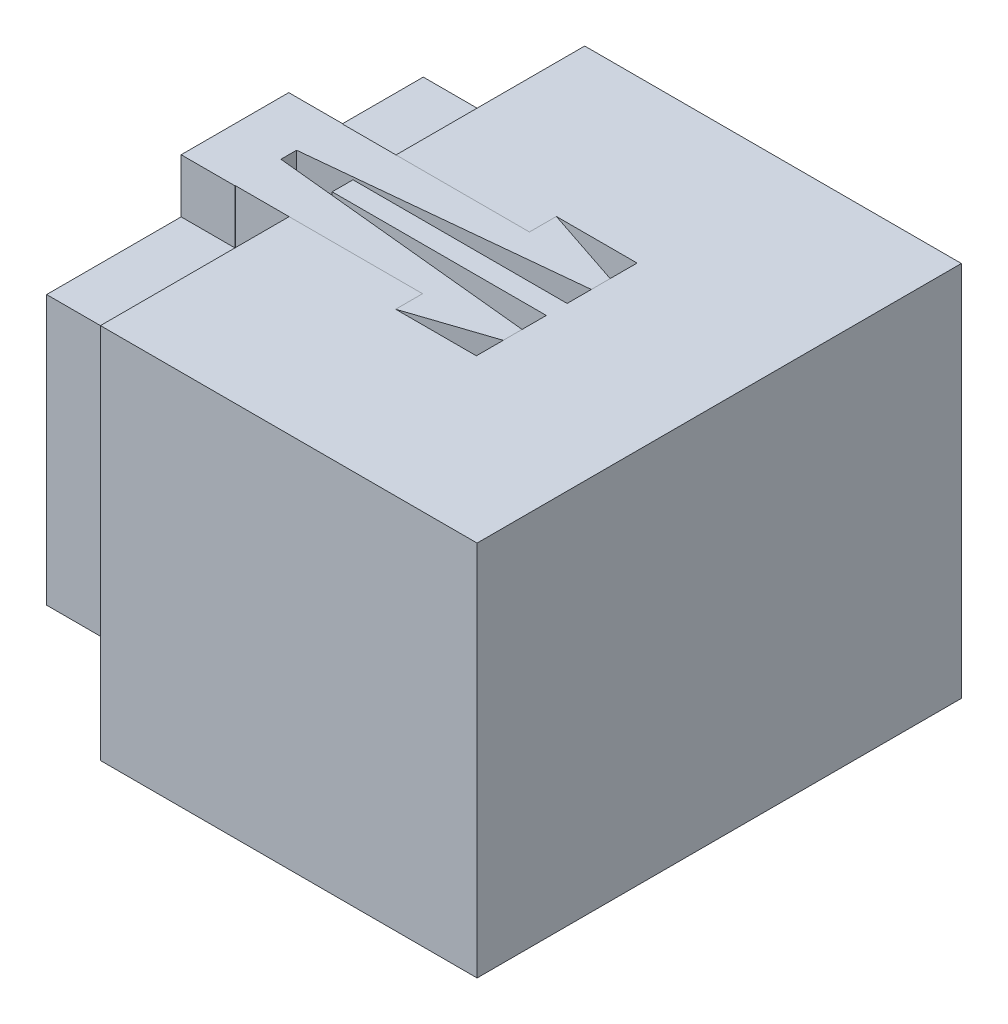
from build123d import *

# Parameters (mm, degrees)
SKETCH1_W                = 7
SKETCH1_H                = 5
BOSS_EXTRUDE1_DEPTH      = 1
SKETCH3_W                = 5
SKETCH3_H                = 4
BOSS_EXTRUDE2_DEPTH      = 7
SKETCH4_W                = 1
SKETCH4_H                = 1
CUT_EXTRUDE1_DEPTH       = 5
CUT_EXTRUDE3_DEPTH       = 4
SKETCH7_W                = 2
SKETCH7_H                = 1
BOSS_EXTRUDE3_DEPTH      = 1
SNAP_START               = 2.5
SNAP_HOOK3_DEPTH         = 1
SKETCH8_R                = 0.5
CUT_EXTRUDE4_DEPTH       = 1
SKETCH9_W                = 9
SKETCH9_H                = 7
BOSS_EXTRUDE4_DEPTH      = 7
SKETCH10_W               = 7
SKETCH10_H               = 5
CUT_EXTRUDE5_DEPTH       = 6
SNAP_START_2             = 2
SNAP_GROOVE1_OUTLINE_W   = 1
SNAP_GROOVE1_OUTLINE_H   = 0.8
SNAP_GROOVE1_DEPTH       = 3.979788025
SNAP_START_3             = 4.479788025
SNAP_GROOVE1_2_OUTLINE_W = 1
SNAP_GROOVE1_2_OUTLINE_H = 0.5
SNAP_GROOVE1_2_DEPTH     = 1.5


# Read off the part's stored shape, not the designer's step: Snap Hook3, Snap Groove1
with BuildPart() as part:
    # Sketch1 → Boss-Extrude1 (new body)
    with BuildSketch(Plane(origin=(0, 0, 0), x_dir=(0, 0, -1), z_dir=(1, 0, 0))):
        Rectangle(SKETCH1_W, SKETCH1_H)
    extrude(amount=BOSS_EXTRUDE1_DEPTH)

    # Sketch3 → Boss-Extrude2 (add)
    with BuildSketch(Plane(origin=(1, 0, 0), x_dir=(0, 0, -1), z_dir=(1, 0, 0))):
        with Locations((0, 0.5)):
            Rectangle(SKETCH3_W, SKETCH3_H)
    extrude(amount=BOSS_EXTRUDE2_DEPTH)

    # Sketch4 → Cut-Extrude1 (cut)
    with BuildSketch(Plane(origin=(8, 0, 0), x_dir=(0, 0, -1), z_dir=(1, 0, 0))):
        with Locations((-1.5, 1.5)):
            Rectangle(SKETCH4_W, SKETCH4_H)
        with Locations((1.5, 1.5)):
            Rectangle(SKETCH4_W, SKETCH4_H)
    extrude(amount=-CUT_EXTRUDE1_DEPTH, mode=Mode.SUBTRACT)

    # Sketch6 → Cut-Extrude3 (cut)
    with BuildSketch(Plane(origin=(8, 0, 0), x_dir=(0, 0, -1), z_dir=(1, 0, 0))):
        Polygon((-1.6, -1.5), (-1.4, -0.8), (-0.6, -0.8), (-0.4, -1.5), align=None)
        Polygon((0.4, -1.5), (1.6, -1.5), (1.4, -0.8), (0.6, -0.8), align=None)
    extrude(amount=-CUT_EXTRUDE3_DEPTH, mode=Mode.SUBTRACT)

    # Sketch7 → Boss-Extrude3 (add)
    with BuildSketch(Plane.ZY):
        with Locations((0, 3)):
            Rectangle(SKETCH7_W, SKETCH7_H)
    extrude(amount=-BOSS_EXTRUDE3_DEPTH)

    # Snap Hook3 outline → Snap Hook3 (add)
    with BuildSketch(Plane(origin=(0, 0, 0), x_dir=(1, 0, 0), z_dir=(0, 1, 0)).offset(SNAP_START)):
        Polygon((5.979788025, 0.993352766), (4.479788025, 1.493352766), (4.479788025, 0.993352766), (1, 0.993352766), (1, 0.145373963), (5.979788025, 0.643352766), align=None)
    snap_hook3 = extrude(amount=SNAP_HOOK3_DEPTH)

    # Mirror1: Snap Hook3 across plane
    add(snap_hook3.mirror(Plane.XY))

    # Sketch8 → Cut-Extrude4 (cut)
    with BuildSketch(Plane.ZY):
        with Locations((-1.5, 0)):
            Circle(SKETCH8_R)
        with Locations((1.5, 0)):
            Circle(SKETCH8_R)
    extrude(amount=-CUT_EXTRUDE4_DEPTH, mode=Mode.SUBTRACT)


with BuildPart() as body_2:
    # Sketch9 → Boss-Extrude4 (new body)
    with BuildSketch(Plane(origin=(9, 0, 0), x_dir=(0, 0, -1), z_dir=(1, 0, 0))):
        Rectangle(SKETCH9_W, SKETCH9_H)
    extrude(amount=-BOSS_EXTRUDE4_DEPTH)

    # Sketch10 → Cut-Extrude5 (cut)
    with BuildSketch(Plane.ZY.offset(-2)):
        Rectangle(SKETCH10_W, SKETCH10_H)
    extrude(amount=-CUT_EXTRUDE5_DEPTH, mode=Mode.SUBTRACT)

    # Snap Groove1 outline → Snap Groove1 (cut)
    with BuildSketch(Plane.YZ.offset(SNAP_START_2)):
        with Locations((3, -0.593352766)):
            Rectangle(SNAP_GROOVE1_OUTLINE_W, SNAP_GROOVE1_OUTLINE_H)
    snap_groove1 = extrude(amount=SNAP_GROOVE1_DEPTH, mode=Mode.SUBTRACT)

    # Snap Groove1 2 outline → Snap Groove1 2 (cut)
    with BuildSketch(Plane.YZ.offset(SNAP_START_3)):
        with Locations((3, -1.243352766)):
            Rectangle(SNAP_GROOVE1_2_OUTLINE_W, SNAP_GROOVE1_2_OUTLINE_H)
    snap_groove1_2 = extrude(amount=SNAP_GROOVE1_2_DEPTH, mode=Mode.SUBTRACT)

    # Mirror2: Snap Groove1, Snap Groove1 2 across plane
    add(snap_groove1.mirror(Plane.XY), mode=Mode.SUBTRACT)
    add(snap_groove1_2.mirror(Plane.XY), mode=Mode.SUBTRACT)


solid = Compound([part.part, body_2.part])
